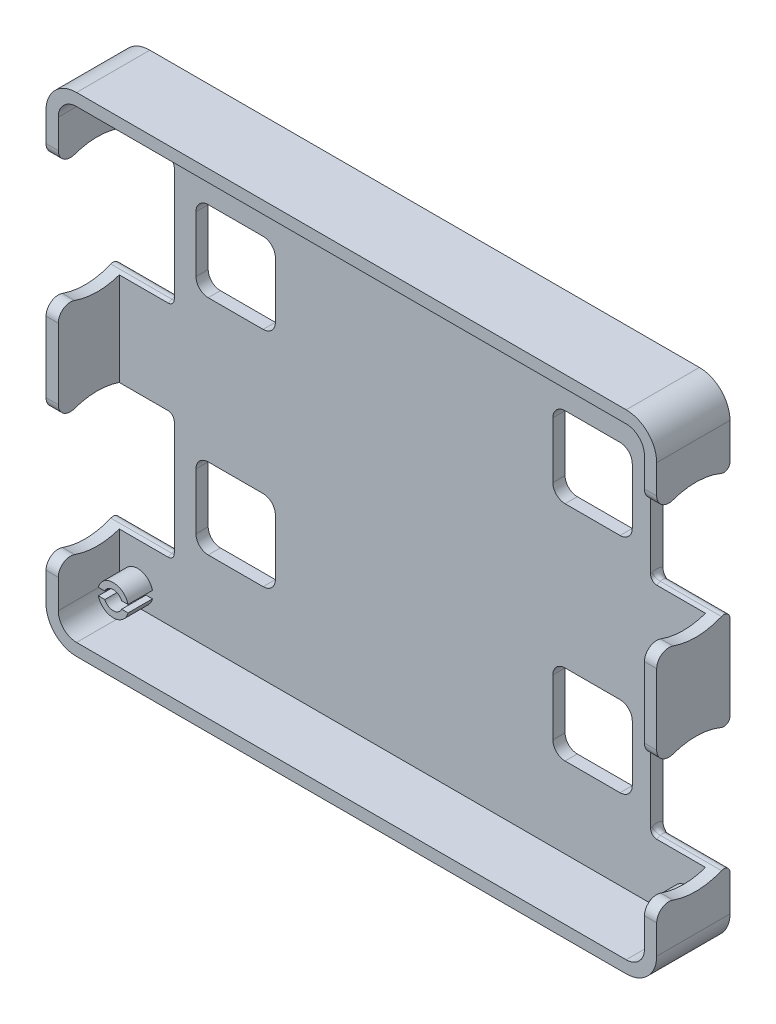
from build123d import *

# Parameters (mm, degrees)
BOSS_EXTRU_1_DEPTH      = 50
BOSS_EXTRU_2_START      = 10
BOSS_EXTRU_2_DEPTH      = 10
BOSS_EXTRU_3_DEPTH      = 20
SYM_TRIE2_COPY_1_DEPTH  = 20
ESQUISSE4_R             = 55
ESQUISSE4_R_2           = 54.99999999999997
ENL_V_MAT_EXTRU_1_DEPTH = 55
CONG_1_R                = 10
CONG_2_R                = 5
CONG_3_R                = 5
ENL_V_MAT_EXTRU_2_DEPTH = 10
CONG_4_R                = 10


with BuildPart() as part:
    # Esquisse1 → Boss.-Extru.1 (new body)
    with BuildSketch(Plane.XY):
        with BuildLine():
            Line((-226.38505493787858, -200.1385054937879), (223.61494506212142, -200.13850549378785))
            ThreePointArc((223.61494506212142, -200.13850549378785), (241.29261459178514, -192.81617502345154), (248.61494506212145, -175.13850549378782))
            Line((248.61494506212145, -175.13850549378782), (248.6149450621214, 174.86149450621215))
            ThreePointArc((248.6149450621214, 174.86149450621215), (241.29261459178508, 192.53916403587587), (223.6149450621214, 199.86149450621218))
            Line((223.6149450621214, 199.86149450621218), (-226.38505493787858, 199.86149450621213))
            ThreePointArc((-226.38505493787858, 199.86149450621213), (-244.0627244675423, 192.5391640358758), (-251.3850549378786, 174.86149450621213))
            Line((-251.3850549378786, 174.86149450621213), (-251.38505493787855, -175.13850549378787))
            ThreePointArc((-251.38505493787855, -175.13850549378787), (-244.06272446754227, -192.81617502345156), (-226.38505493787858, -200.1385054937879))
        make_face()
        with BuildLine():
            Line((-241.3850549378786, 174.86149450621213), (-241.3850549378786, -175.13850549378785))
            ThreePointArc((-241.3850549378786, -175.13850549378785), (-236.99165665567682, -185.74510721158612), (-226.38505493787858, -190.13850549378787))
            Line((-226.38505493787858, -190.13850549378787), (223.61494506212142, -190.13850549378787))
            ThreePointArc((223.61494506212142, -190.13850549378787), (234.2215467799197, -185.7451072115861), (238.61494506212148, -175.13850549378782))
            Line((238.61494506212148, -175.13850549378782), (238.61494506212145, 174.86149450621215))
            ThreePointArc((238.61494506212145, 174.86149450621215), (234.22154677991966, 185.46809622401042), (223.6149450621214, 189.86149450621218))
            Line((223.6149450621214, 189.86149450621218), (-226.38505493787855, 189.86149450621218))
            ThreePointArc((-226.38505493787855, 189.86149450621218), (-236.99165665567685, 185.4680962240104), (-241.3850549378786, 174.86149450621213))
        make_face(mode=Mode.SUBTRACT)
    extrude(amount=BOSS_EXTRU_1_DEPTH)

    # Esquisse2 → Boss.-Extru.2 (add)
    with BuildSketch(Plane(origin=(0, 0, 0), x_dir=(-1, 0, 0), z_dir=(0, 0, -1)).offset(BOSS_EXTRU_2_START)):
        with BuildLine():
            Line((251.38505493787855, -175.1385054937879), (251.3850549378786, 174.86149450621213))
            ThreePointArc((251.3850549378786, 174.86149450621213), (244.0627244675423, 192.5391640358758), (226.38505493787858, 199.86149450621213))
            Line((226.38505493787858, 199.86149450621213), (-223.6149450621214, 199.86149450621218))
            ThreePointArc((-223.6149450621214, 199.86149450621218), (-241.29261459178508, 192.53916403587587), (-248.6149450621214, 174.86149450621215))
            Line((-248.6149450621214, 174.86149450621215), (-248.61494506212145, -175.13850549378782))
            ThreePointArc((-248.61494506212145, -175.13850549378782), (-241.29261459178514, -192.8161750234515), (-223.61494506212142, -200.13850549378782))
            Line((-223.61494506212142, -200.13850549378782), (226.38505493787858, -200.13850549378787))
            ThreePointArc((226.38505493787858, -200.13850549378787), (244.06272446754224, -192.81617502345156), (251.38505493787855, -175.1385054937879))
        make_face()
    extrude(amount=-BOSS_EXTRU_2_DEPTH)

    # Esquisse3 → Boss.-Extru.3 (add)
    with BuildSketch(Plane.XY):
        with BuildLine():
            Line((-238.5197160373902, 177.86149450621213), (-233.2589184803124, 177.86149450621213))
            ThreePointArc((-233.2589184803124, 177.86149450621213), (-226.38505493787864, 182.36149450621213), (-219.51119139544485, 177.86149450621215))
            Line((-219.51119139544485, 177.86149450621215), (-214.25039383836702, 177.86149450621215))
            ThreePointArc((-214.25039383836702, 177.86149450621215), (-226.38505493787864, 187.36149450621213), (-238.5197160373902, 177.86149450621213))
        make_face()
        with BuildLine():
            Line((-238.5197160373902, 171.86149450621213), (-233.2589184803124, 171.86149450621213))
            ThreePointArc((-233.2589184803124, 171.86149450621213), (-226.38505493787864, 167.3614945062121), (-219.51119139544485, 171.8614945062121))
            Line((-219.51119139544485, 171.8614945062121), (-214.25039383836702, 171.8614945062121))
            ThreePointArc((-214.25039383836702, 171.8614945062121), (-226.3850549378786, 162.36149450621213), (-238.5197160373902, 171.86149450621213))
        make_face()
    boss_extru_3 = extrude(amount=BOSS_EXTRU_3_DEPTH)

    # Symétrie1: Boss.-Extru.3 across plane
    add(boss_extru_3.mirror(Plane(origin=(-1.385054937878577, -2.2e-16, 0), x_dir=(0, 0, 1), z_dir=(1, 1.6e-16, 0))))

    # Symétrie2: Boss.-Extru.3 across plane
    add(boss_extru_3.mirror(Plane.ZX.offset(-0.13850549378785476)))

    # Symétrie2 copy 1 sketch → Symétrie2 copy 1 (add)
    with BuildSketch(Plane(origin=(-2.770109875757154, -0.27701098757570974, 0), x_dir=(-1, 7e-17, 0), z_dir=(0, 0, 1))):
        with BuildLine():
            Line((-238.5197160373902, 177.86149450621213), (-233.2589184803124, 177.86149450621213))
            ThreePointArc((-233.2589184803124, 177.86149450621213), (-226.38505493787864, 182.36149450621213), (-219.51119139544485, 177.86149450621215))
            Line((-219.51119139544485, 177.86149450621215), (-214.25039383836702, 177.86149450621215))
            ThreePointArc((-214.25039383836702, 177.86149450621215), (-226.38505493787864, 187.36149450621213), (-238.5197160373902, 177.86149450621213))
        make_face()
        with BuildLine():
            Line((-238.5197160373902, 171.86149450621213), (-233.2589184803124, 171.86149450621213))
            ThreePointArc((-233.2589184803124, 171.86149450621213), (-226.38505493787864, 167.3614945062121), (-219.51119139544485, 171.8614945062121))
            Line((-219.51119139544485, 171.8614945062121), (-214.25039383836702, 171.8614945062121))
            ThreePointArc((-214.25039383836702, 171.8614945062121), (-226.3850549378786, 162.36149450621213), (-238.5197160373902, 171.86149450621213))
        make_face()
    extrude(amount=SYM_TRIE2_COPY_1_DEPTH)

    # Esquisse4 → Enlèv. mat.-Extru.1 (cut)
    with BuildSketch(Plane(origin=(248.61494506212142, 3.943e-14, 0), x_dir=(0, 0, -1), z_dir=(1, 1.6e-16, 0))):
        with Locations((-18.08668372258571, -90.23541814714768)):
            Circle(ESQUISSE4_R)
        with Locations((-18.08668372258571, 89.95840715957198)):
            Circle(ESQUISSE4_R_2)
    enl_v_mat_extru_1 = extrude(amount=-ENL_V_MAT_EXTRU_1_DEPTH, mode=Mode.SUBTRACT)

    # Symétrie3: Enlèv. mat.-Extru.1 across plane
    add(enl_v_mat_extru_1.mirror(Plane(origin=(-1.385054937878577, -2.2e-16, 0), x_dir=(0, 0, 1), z_dir=(1, 1.6e-16, 0))), mode=Mode.SUBTRACT)

    # Congé1
    cong_1_edges = [part.edges().sort_by_distance(p)[0] for p in [
        (243.61494506212148, -135.02984016794977, 50),
        (243.61494506212145, -45.440996126345496, 50),
        (243.61494506212142, 45.16398513876991, 50),
        (243.61494506212142, 134.75282918037414, 50),
        (-246.38505493787858, -135.02984016794989, 50),
        (-246.38505493787858, -45.44099612634558, 50),
        (-246.38505493787858, 45.163985138769824, 50),
        (-246.38505493787858, 134.75282918037405, 50),
    ]]
    fillet(cong_1_edges, radius=CONG_1_R)

    # Congé2
    cong_2_edges = [part.edges().sort_by_distance(p)[0] for p in [
        (221.11494506212142, 42.67058422948317, -10),
        (221.1149450621214, 137.24623008966086, -10),
        (221.11494506212145, -137.52324107723652, -10),
        (221.11494506212142, -42.947595217058776, -10),
        (-223.88505493787858, 137.24623008966077, -10),
        (-223.88505493787858, 42.6705842294831, -10),
        (-223.88505493787858, -42.94759521705885, -10),
        (-223.88505493787858, -137.5232410772366, -10),
    ]]
    fillet(cong_2_edges, radius=CONG_2_R)

    # Congé3
    # the kernel refuses this fillet: 5 mm, written as the material it adds along each edge
    with BuildSketch(Plane(origin=(193.61494506212145, -90.23541814714766, 18.08668372258571), x_dir=(0, -0.9941939723127525, -0.10760272030478603), z_dir=(0, -0.10760272030478603, 0.9941939723127525))) as cong_3_piece_1_section:
        with BuildLine():
            CenterArc((54.999999999999986 - CONG_3_R, CONG_3_R), CONG_3_R, 270, 90)
            Line((54.999999999999986, CONG_3_R), (54.999999999999986, 0))
            Line((54.999999999999986, 0), (54.999999999999986 - CONG_3_R, 0))
        make_face()
    cong_3_piece_1 = revolve(axis=Axis((193.61494506212145, -90.23541814714766, 18.08668372258571), (1, 1.6e-16, 0)), revolution_arc=16.452821520639674, mode=Mode.PRIVATE)
    cong_3_piece_1 = split(cong_3_piece_1, bisect_by=Plane(origin=(194.80638110481462, -140.61876286027467, 0), z_dir=(0, 0, -1)), keep=Keep.TOP, mode=Mode.PRIVATE)
    add(cong_3_piece_1)
    with BuildSketch(Plane(origin=(193.6149450621214, 89.958407159572, 18.08668372258571), x_dir=(0, -0.9941939723127525, -0.10760272030478607), z_dir=(0, -0.10760272030478607, 0.9941939723127525))) as cong_3_piece_2_section:
        with BuildLine():
            CenterArc((54.99999999999997 - CONG_3_R, CONG_3_R), CONG_3_R, 269.9999999999999, 89.99999999999973)
            Line((54.99999999999997, CONG_3_R), (54.99999999999997, -2.842e-14))
            Line((54.99999999999997, -2.842e-14), (54.99999999999997 - CONG_3_R, -2.584e-14))
        make_face()
    cong_3_piece_2 = revolve(axis=Axis((193.6149450621214, 89.958407159572, 18.08668372258571), (1, 1.6e-16, 0)), revolution_arc=16.452821520639702, mode=Mode.PRIVATE)
    cong_3_piece_2 = split(cong_3_piece_2, bisect_by=Plane(origin=(194.80638110481453, 39.57506244644502, 0), z_dir=(0, 0, -1)), keep=Keep.TOP, mode=Mode.PRIVATE)
    add(cong_3_piece_2)
    with BuildSketch(Plane(origin=(-196.38505493787858, -90.23541814714771, 18.08668372258571), x_dir=(0, -0.9941939723127523, -0.10760272030478689), z_dir=(0, -0.10760272030478689, 0.9941939723127523))) as cong_3_piece_3_section:
        with BuildLine():
            CenterArc((54.99999999999998 - CONG_3_R, -CONG_3_R), CONG_3_R, 0, 90)
            Line((54.99999999999998, -CONG_3_R), (54.99999999999998, 0))
            Line((54.99999999999998, 0), (54.99999999999998 - CONG_3_R, 0))
        make_face()
    cong_3_piece_3 = revolve(axis=Axis((-196.38505493787858, -90.23541814714771, 18.08668372258571), (1, 1.6e-16, 0)), revolution_arc=16.452821520639603, mode=Mode.PRIVATE)
    cong_3_piece_3 = split(cong_3_piece_3, bisect_by=Plane(origin=(-197.57649109779356, -140.61876286255483, 0), z_dir=(0, 0, -1)), keep=Keep.TOP, mode=Mode.PRIVATE)
    add(cong_3_piece_3)
    with BuildSketch(Plane(origin=(-196.38505493787858, 89.95840715957195, 18.08668372258571), x_dir=(0, -0.9941939723127526, -0.10760272030478424), z_dir=(0, -0.10760272030478424, 0.9941939723127526))) as cong_3_piece_4_section:
        with BuildLine():
            CenterArc((54.99999999999998 - CONG_3_R, -CONG_3_R), CONG_3_R, 0, 90)
            Line((54.99999999999998 - CONG_3_R, -2.842e-14), (54.99999999999998, 0))
            Line((54.99999999999998, 0), (54.99999999999998, -CONG_3_R))
        make_face()
    cong_3_piece_4 = revolve(axis=Axis((-196.38505493787858, 89.95840715957195, 18.08668372258571), (1, 1.6e-16, 0)), revolution_arc=16.45282152063977, mode=Mode.PRIVATE)
    cong_3_piece_4 = split(cong_3_piece_4, bisect_by=Plane(origin=(-197.5764910967497, 39.57506244678789, 0), z_dir=(0, 0, -1)), keep=Keep.TOP, mode=Mode.PRIVATE)
    add(cong_3_piece_4)
    with BuildSketch(Plane(origin=(-196.38505493787858, -90.23541814714771, 18.08668372258571), x_dir=(0, 0.923009123990852, -0.3847780620430953), z_dir=(0, -0.3847780620430953, -0.923009123990852))) as cong_3_piece_5_section:
        with BuildLine():
            CenterArc((55 - CONG_3_R, -CONG_3_R), CONG_3_R, 3.2569e-13, 89.99999999999966)
            Line((55, -CONG_3_R), (55, 0))
            Line((55, 0), (55 - CONG_3_R, 0))
        make_face()
    cong_3_piece_5 = revolve(axis=Axis((-196.38505493787858, -90.23541814714771, 18.08668372258571), (1, 1.6e-16, 0)), revolution_arc=16.45282152063967, mode=Mode.PRIVATE)
    cong_3_piece_5 = split(cong_3_piece_5, bisect_by=Plane(origin=(-197.57649128005482, -39.852073382930705, 0), z_dir=(0, 0, -1)), keep=Keep.TOP, mode=Mode.PRIVATE)
    add(cong_3_piece_5)
    with BuildSketch(Plane(origin=(-196.38505493787858, 89.95840715957195, 18.08668372258571), x_dir=(0, 0.9230091239908519, -0.38477806204309545), z_dir=(0, -0.38477806204309545, -0.9230091239908519))) as cong_3_piece_6_section:
        with BuildLine():
            CenterArc((54.99999999999996 - CONG_3_R, -CONG_3_R), CONG_3_R, 0, 90)
            Line((54.99999999999996, -CONG_3_R), (54.99999999999996, 0))
            Line((54.99999999999996, 0), (54.99999999999996 - CONG_3_R, 0))
        make_face()
    cong_3_piece_6 = revolve(axis=Axis((-196.38505493787858, 89.95840715957195, 18.08668372258571), (1, 1.6e-16, 0)), revolution_arc=16.452821520639688, mode=Mode.PRIVATE)
    cong_3_piece_6 = split(cong_3_piece_6, bisect_by=Plane(origin=(-197.57649128005482, 140.34175192378888, 0), z_dir=(0, 0, -1)), keep=Keep.TOP, mode=Mode.PRIVATE)
    add(cong_3_piece_6)
    with BuildSketch(Plane(origin=(193.6149450621214, 89.958407159572, 18.08668372258571), x_dir=(0, 0.923009123990852, -0.38477806204309517), z_dir=(0, -0.38477806204309517, -0.923009123990852))) as cong_3_piece_7_section:
        with BuildLine():
            CenterArc((54.999999999999986 - CONG_3_R, CONG_3_R), CONG_3_R, 270, 90)
            Line((54.999999999999986 - CONG_3_R, 0), (54.999999999999986, 0))
            Line((54.999999999999986, 0), (54.999999999999986, CONG_3_R))
        make_face()
    cong_3_piece_7 = revolve(axis=Axis((193.6149450621214, 89.958407159572, 18.08668372258571), (1, 1.6e-16, 0)), revolution_arc=16.452821520639695, mode=Mode.PRIVATE)
    cong_3_piece_7 = split(cong_3_piece_7, bisect_by=Plane(origin=(194.80638131037927, 140.34175192317142, 0), z_dir=(0, 0, -1)), keep=Keep.TOP, mode=Mode.PRIVATE)
    add(cong_3_piece_7)
    with BuildSketch(Plane(origin=(193.61494506212145, -90.23541814714766, 18.08668372258571), x_dir=(0, 0.923009123990852, -0.3847780620430952), z_dir=(0, -0.3847780620430952, -0.923009123990852))) as cong_3_piece_8_section:
        with BuildLine():
            CenterArc((55.00000000000001 - CONG_3_R, CONG_3_R), CONG_3_R, 269.9999999999999, 90.00000000000011)
            Line((55.00000000000001 - CONG_3_R, 2.584e-14), (55.00000000000001, 0))
            Line((55.00000000000001, 0), (55.00000000000001, CONG_3_R))
        make_face()
    cong_3_piece_8 = revolve(axis=Axis((193.61494506212145, -90.23541814714766, 18.08668372258571), (1, 1.6e-16, 0)), revolution_arc=16.45282152063975, mode=Mode.PRIVATE)
    cong_3_piece_8 = split(cong_3_piece_8, bisect_by=Plane(origin=(194.8063813103793, -39.852073383548245, 0), z_dir=(0, 0, -1)), keep=Keep.TOP, mode=Mode.PRIVATE)
    add(cong_3_piece_8)
    with BuildSketch(Plane(origin=(-196.38505493787858, -145.61596558659886, -5), x_dir=(0, 0.923009123990851, 0.3847780620430978), z_dir=(0, -0.3847780620430978, 0.923009123990851))) as cong_3_piece_9_section:
        with BuildLine():
            CenterArc((5.000000000000005 + CONG_3_R, CONG_3_R), CONG_3_R, 180, 90)
            Line((5.000000000000005, CONG_3_R), (5.000000000000005, 0))
            Line((5.000000000000005, 0), (5.000000000000005 + CONG_3_R, 0))
        make_face()
    cong_3_piece_9 = revolve(axis=Axis((-196.38505493787858, -145.61596558659886, -5), (-1, -1.6e-16, 0)), revolution_arc=255.95954071151726, mode=Mode.PRIVATE)
    cong_3_piece_9 = split(cong_3_piece_9, bisect_by=Plane(origin=(-197.18293484006966, -139.15350873951596, 0), z_dir=(0, 0, -1)), keep=Keep.TOP, mode=Mode.PRIVATE)
    cong_3_piece_9 = split(cong_3_piece_9, bisect_by=Plane(origin=(-197.18293484006966, -139.15350873951596, -10), z_dir=(0, 0, 1)), keep=Keep.TOP, mode=Mode.PRIVATE)
    add(cong_3_piece_9)
    with BuildSketch(Plane(origin=(-196.3850549378786, -34.8548707076966, -5), x_dir=(0, 0.5972111648333894, 0.8020840508315485), z_dir=(0, -0.8020840508315485, 0.5972111648333894))) as cong_3_piece_10_section:
        with BuildLine():
            CenterArc((5 + CONG_3_R, CONG_3_R), CONG_3_R, 180, 90)
            Line((5.000000000000005, CONG_3_R), (5, -2.842e-14))
            Line((5, -2.842e-14), (5 + CONG_3_R, -2.842e-14))
        make_face()
    cong_3_piece_10 = revolve(axis=Axis((-196.3850549378786, -34.8548707076966, -5), (-1, -1.6e-16, 0)), revolution_arc=255.95954071151667, mode=Mode.PRIVATE)
    cong_3_piece_10 = split(cong_3_piece_10, bisect_by=Plane(origin=(-197.7287462453581, -39.44705563827431, 0), z_dir=(0, 0, -1)), keep=Keep.TOP, mode=Mode.PRIVATE)
    cong_3_piece_10 = split(cong_3_piece_10, bisect_by=Plane(origin=(-197.7287462453581, -39.44705563827431, -10), z_dir=(0, 0, 1)), keep=Keep.TOP, mode=Mode.PRIVATE)
    add(cong_3_piece_10)
    with BuildSketch(Plane(origin=(-196.38505493787855, 34.57785972012085, -5), x_dir=(0, -0.5972111648333858, 0.8020840508315512), z_dir=(0, 0.8020840508315512, 0.5972111648333858))) as cong_3_piece_11_section:
        with BuildLine():
            CenterArc((5 + CONG_3_R, -CONG_3_R), CONG_3_R, 90.00000000000003, 90)
            Line((5 + CONG_3_R, -2.842e-14), (5, -2.842e-14))
            Line((5, -2.842e-14), (5, -CONG_3_R))
        make_face()
    cong_3_piece_11 = revolve(axis=Axis((-196.38505493787855, 34.57785972012085, -5), (1, 1.6e-16, 0)), revolution_arc=255.95954071151692, mode=Mode.PRIVATE)
    cong_3_piece_11 = split(cong_3_piece_11, bisect_by=Plane(origin=(-197.72874550936353, 39.17004393124987, 0), z_dir=(0, 0, -1)), keep=Keep.TOP, mode=Mode.PRIVATE)
    cong_3_piece_11 = split(cong_3_piece_11, bisect_by=Plane(origin=(-197.72874550936353, 39.17004393124987, -10), z_dir=(0, 0, 1)), keep=Keep.TOP, mode=Mode.PRIVATE)
    add(cong_3_piece_11)
    with BuildSketch(Plane(origin=(-196.38505493787858, 145.33895459902303, -5), x_dir=(0, 0.5972111648333849, 0.802084050831552), z_dir=(0, -0.802084050831552, 0.5972111648333849))) as cong_3_piece_12_section:
        with BuildLine():
            CenterArc((4.999999999999999 + CONG_3_R, CONG_3_R), CONG_3_R, 180, 89.99999999999994)
            Line((4.999999999999999 + CONG_3_R, 0), (4.999999999999999, 0))
            Line((4.999999999999999, 0), (5.000000000000001, CONG_3_R))
        make_face()
    cong_3_piece_12 = revolve(axis=Axis((-196.38505493787858, 145.33895459902303, -5), (-1, -1.6e-16, 0)), revolution_arc=255.95954071151712, mode=Mode.PRIVATE)
    cong_3_piece_12 = split(cong_3_piece_12, bisect_by=Plane(origin=(-197.72874628309077, 140.74676981251272, 0), z_dir=(0, 0, -1)), keep=Keep.TOP, mode=Mode.PRIVATE)
    cong_3_piece_12 = split(cong_3_piece_12, bisect_by=Plane(origin=(-197.72874628309077, 140.74676981251272, -10), z_dir=(0, 0, 1)), keep=Keep.TOP, mode=Mode.PRIVATE)
    add(cong_3_piece_12)
    with BuildSketch(Plane(origin=(193.6149450621214, 145.3389545990231, -5), x_dir=(0, 0.5972111648333851, 0.8020840508315519), z_dir=(0, -0.8020840508315519, 0.5972111648333851))) as cong_3_piece_13_section:
        with BuildLine():
            CenterArc((4.999999999999998 + CONG_3_R, -CONG_3_R), CONG_3_R, 90.00000000000006, 89.99999999999994)
            Line((4.999999999999998 + CONG_3_R, 0), (4.999999999999998, 0))
            Line((4.999999999999998, 0), (5.000000000000001, -CONG_3_R))
        make_face()
    cong_3_piece_13 = revolve(axis=Axis((193.6149450621214, 145.3389545990231, -5), (-1, -1.6e-16, 0)), revolution_arc=255.95954071151712, mode=Mode.PRIVATE)
    cong_3_piece_13 = split(cong_3_piece_13, bisect_by=Plane(origin=(194.9586364991696, 140.74676986300364, 0), z_dir=(0, 0, -1)), keep=Keep.TOP, mode=Mode.PRIVATE)
    cong_3_piece_13 = split(cong_3_piece_13, bisect_by=Plane(origin=(194.9586364991696, 140.74676986300364, -10), z_dir=(0, 0, 1)), keep=Keep.TOP, mode=Mode.PRIVATE)
    add(cong_3_piece_13)
    with BuildSketch(Plane(origin=(193.61494506212142, 34.57785972012092, -5), x_dir=(0, -0.5972111648333872, 0.8020840508315501), z_dir=(0, 0.8020840508315501, 0.5972111648333872))) as cong_3_piece_14_section:
        with BuildLine():
            CenterArc((4.999999999999997 + CONG_3_R, CONG_3_R), CONG_3_R, 180, 90)
            Line((4.999999999999999, CONG_3_R), (4.999999999999997, -2.842e-14))
            Line((4.999999999999997, -2.842e-14), (4.999999999999997 + CONG_3_R, -2.842e-14))
        make_face()
    cong_3_piece_14 = revolve(axis=Axis((193.61494506212142, 34.57785972012092, -5), (1, 1.6e-16, 0)), revolution_arc=255.95954071151687, mode=Mode.PRIVATE)
    cong_3_piece_14 = split(cong_3_piece_14, bisect_by=Plane(origin=(194.9586357190958, 39.17004390459478, 0), z_dir=(0, 0, -1)), keep=Keep.TOP, mode=Mode.PRIVATE)
    cong_3_piece_14 = split(cong_3_piece_14, bisect_by=Plane(origin=(194.9586357190958, 39.17004390459478, -10), z_dir=(0, 0, 1)), keep=Keep.TOP, mode=Mode.PRIVATE)
    add(cong_3_piece_14)
    with BuildSketch(Plane(origin=(193.61494506212142, -34.85487070769653, -5), x_dir=(0, 0.5972111648333871, 0.8020840508315503), z_dir=(0, -0.8020840508315503, 0.5972111648333871))) as cong_3_piece_15_section:
        with BuildLine():
            CenterArc((5.000000000000001 + CONG_3_R, -CONG_3_R), CONG_3_R, 90, 90)
            Line((5.000000000000001 + CONG_3_R, -2.842e-14), (5.000000000000001, -2.842e-14))
            Line((5.000000000000001, -2.842e-14), (5.000000000000001, -CONG_3_R))
        make_face()
    cong_3_piece_15 = revolve(axis=Axis((193.61494506212142, -34.85487070769653, -5), (-1, -1.6e-16, 0)), revolution_arc=255.95954071151687, mode=Mode.PRIVATE)
    cong_3_piece_15 = split(cong_3_piece_15, bisect_by=Plane(origin=(194.95863649916845, -39.447055443711456, 0), z_dir=(0, 0, -1)), keep=Keep.TOP, mode=Mode.PRIVATE)
    cong_3_piece_15 = split(cong_3_piece_15, bisect_by=Plane(origin=(194.95863649916845, -39.447055443711456, -10), z_dir=(0, 0, 1)), keep=Keep.TOP, mode=Mode.PRIVATE)
    add(cong_3_piece_15)
    with BuildSketch(Plane(origin=(193.61494506212145, -145.61596558659875, -5), x_dir=(0, -0.5972111648333854, 0.8020840508315517), z_dir=(0, 0.8020840508315517, 0.5972111648333854))) as cong_3_piece_16_section:
        with BuildLine():
            CenterArc((5.000000000000013 + CONG_3_R, CONG_3_R), CONG_3_R, 180, 90)
            Line((5.000000000000008, CONG_3_R), (5.000000000000013, 0))
            Line((5.000000000000013, 0), (5.000000000000013 + CONG_3_R, 0))
        make_face()
    cong_3_piece_16 = revolve(axis=Axis((193.61494506212145, -145.61596558659875, -5), (1, 1.6e-16, 0)), revolution_arc=255.95954071151704, mode=Mode.PRIVATE)
    cong_3_piece_16 = split(cong_3_piece_16, bisect_by=Plane(origin=(194.95865482211173, -141.02379026940167, 0), z_dir=(0, 0, -1)), keep=Keep.TOP, mode=Mode.PRIVATE)
    cong_3_piece_16 = split(cong_3_piece_16, bisect_by=Plane(origin=(194.95865482211173, -141.02379026940167, -10), z_dir=(0, 0, 1)), keep=Keep.TOP, mode=Mode.PRIVATE)
    add(cong_3_piece_16)

    # Esquisse5 → Enlèv. mat.-Extru.2 (cut)
    with BuildSketch(Plane(origin=(0, 0, -10), x_dir=(-1, 0, 0), z_dir=(0, 0, -1))):
        Polygon((178.61494506212148, -58.21807206569577), (113.60696279948691, -58.2180720656958), (113.60696279948688, -124.2089443855258), (178.61494506212148, -124.20894438552575), align=None)
        Polygon((-178.61494506212148, -124.20894438552575), (-113.60696279948688, -124.2089443855258), (-113.60696279948691, -58.2180720656958), (-178.61494506212148, -58.21807206569577), align=None)
        Polygon((-178.61494506212145, 58.21807206569573), (-178.61494506212145, 124.20894438552573), (-113.60696279948685, 124.20894438552574), (-113.6069627994869, 58.21807206569574), align=None)
        Polygon((178.61494506212145, 124.20894438552573), (113.60696279948685, 124.20894438552574), (113.6069627994869, 58.21807206569574), (178.61494506212145, 58.21807206569573), align=None)
    extrude(amount=-ENL_V_MAT_EXTRU_2_DEPTH, mode=Mode.SUBTRACT)

    # Congé4
    cong_4_edges = [part.edges().sort_by_distance(p)[0] for p in [
        (-178.61494506212145, 124.20894438552573, -5),
        (-178.61494506212145, 58.21807206569573, -5),
        (-113.6069627994869, 58.21807206569574, -5),
        (-113.60696279948685, 124.20894438552574, -5),
        (113.6069627994869, 58.21807206569574, -5),
        (178.61494506212145, 58.21807206569573, -5),
        (178.61494506212145, 124.20894438552573, -5),
        (113.60696279948685, 124.20894438552574, -5),
        (178.61494506212148, -124.20894438552575, -5),
        (178.61494506212148, -58.21807206569577, -5),
        (113.60696279948691, -58.2180720656958, -5),
        (113.60696279948688, -124.2089443855258, -5),
        (-178.61494506212148, -58.21807206569577, -5),
        (-178.61494506212148, -124.20894438552575, -5),
        (-113.60696279948688, -124.2089443855258, -5),
        (-113.60696279948691, -58.2180720656958, -5),
    ]]
    fillet(cong_4_edges, radius=CONG_4_R)


solid = part.part
